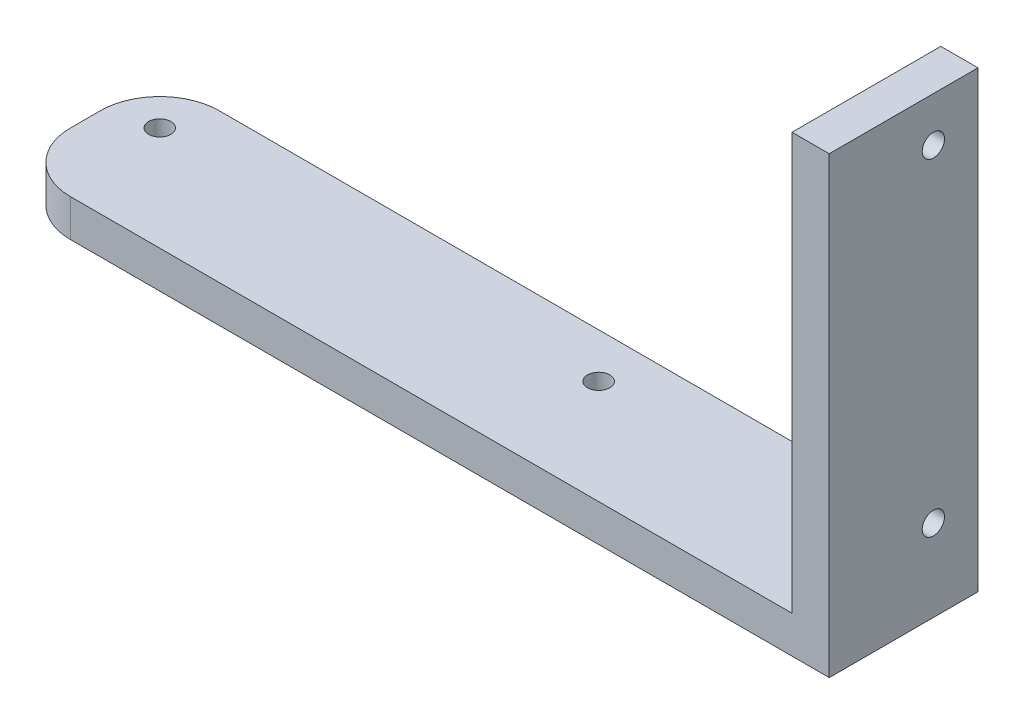
from build123d import *

# Parameters (mm, degrees)
SKETCH1_W           = 110
SKETCH1_H           = 20
BOSS_EXTRUDE1_DEPTH = 5
SKETCH2_W           = 5
SKETCH2_H           = 20
BOSS_EXTRUDE2_DEPTH = 56
SKETCH3_R           = 1.5
CUT_EXTRUDE1_DEPTH  = 126.043992259
FILLET1_R           = 8
SKETCH4_R           = 1.5
CUT_EXTRUDE2_DEPTH  = 124.069086289


with BuildPart() as part:
    # Sketch1 → Boss-Extrude1 (new body)
    with BuildSketch(Plane(origin=(0, 0, 0), x_dir=(1, 0, 0), z_dir=(0, 1, 0))):
        with Locations((55, 10)):
            Rectangle(SKETCH1_W, SKETCH1_H)
    extrude(amount=BOSS_EXTRUDE1_DEPTH)

    # Sketch2 → Boss-Extrude2 (add)
    with BuildSketch(Plane(origin=(0, 5, 0), x_dir=(1, 0, 0), z_dir=(0, 1, 0))):
        with Locations((107.5, 10)):
            Rectangle(SKETCH2_W, SKETCH2_H)
    extrude(amount=BOSS_EXTRUDE2_DEPTH)

    # Sketch3 → Cut-Extrude1 (cut, through all)
    with BuildSketch(Plane(origin=(0, 5, 0), x_dir=(1, 0, 0), z_dir=(0, 1, 0))):
        with Locations((6, 14)):
            Circle(SKETCH3_R)
        with Locations((65, 14)):
            Circle(SKETCH3_R)
    extrude(amount=-CUT_EXTRUDE1_DEPTH, mode=Mode.SUBTRACT)

    # Fillet1
    fillet1_edges = [part.edges().sort_by_distance(p)[0] for p in [
        (0, 2.5, 0),
        (0, 2.5, -20),
    ]]
    fillet(fillet1_edges, radius=FILLET1_R)

    # Sketch4 → Cut-Extrude2 (cut, through all)
    with BuildSketch(Plane.ZY.offset(-105)):
        with Locations((-14, 11)):
            Circle(SKETCH4_R)
        with Locations((-14, 55)):
            Circle(SKETCH4_R)
    extrude(amount=-CUT_EXTRUDE2_DEPTH, mode=Mode.SUBTRACT)


solid = part.part
